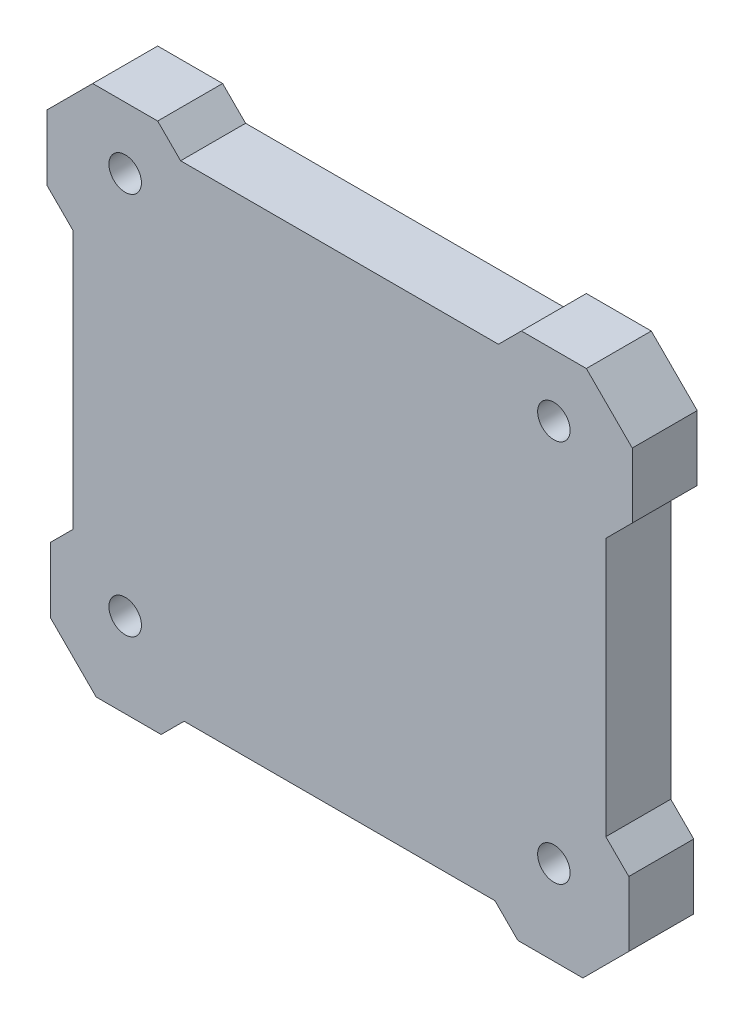
from build123d import *

# Parameters (mm, degrees)
CROQUIS1_W                   = 82
CROQUIS1_H                   = 78
CROQUIS1_R                   = 2.5
SALIENTE_EXTRUIR5_DEPTH      = 10
SALIENTE_EXTRUIR7_DEPTH      = 10
CORTAR_EXTRUIR_L_MINA1_START = -10
CORTAR_EXTRUIR_L_MINA1_DEPTH = 10


# Read off the part's stored shape, not the designer's step: Cortar-Extruir-Lámina1
with BuildPart() as part:
    # Croquis1 → Saliente-Extruir5 (new body)
    with BuildSketch(Plane.XY):
        Rectangle(CROQUIS1_W, CROQUIS1_H)
        with Locations((-33, 29.5)):
            Circle(CROQUIS1_R, mode=Mode.SUBTRACT)
        with Locations((33, 29.5)):
            Circle(CROQUIS1_R, mode=Mode.SUBTRACT)
        with Locations((33, -29.5)):
            Circle(CROQUIS1_R, mode=Mode.SUBTRACT)
        with Locations((-33, -29.5)):
            Circle(CROQUIS1_R, mode=Mode.SUBTRACT)
    extrude(amount=SALIENTE_EXTRUIR5_DEPTH)

    # Croquis6 → Saliente-Extruir7 (add, through all)
    with BuildSketch(Plane.XY.offset(10)):
        Polygon((-41, 17.857864376), (-41, 36), (-45.071067812, 31.928932188), (-45.071067812, 21.928932188), align=None)
        Polygon((45.071067812, 31.928932188), (41, 36), (41, 17.857864376), (45.071067812, 21.928932188), align=None)
        Polygon((-41, -39), (-41, -21.928932188), (-44.535533906, -25.464466094), (-44.535533906, -35.464466094), align=None)
        Polygon((44.535533906, -25.464466094), (41, -21.928932188), (41, -39), (44.535533906, -35.464466094), align=None)
        Polygon((-23.928932188, -39), (-41, -39), (-37.464466094, -42.535533906), (-27.464466094, -42.535533906), align=None)
        Polygon((37.464466094, -42.535533906), (41, -39), (23.928932188, -39), (27.464466094, -42.535533906), align=None)
    extrude(amount=-SALIENTE_EXTRUIR7_DEPTH)

    # Cortar-Extruir-Lámina1 outline → Cortar-Extruir-Lámina1 (cut)
    with BuildSketch(Plane.XY.offset(10).offset(CORTAR_EXTRUIR_L_MINA1_START)):
        Polygon((41, 39), (38, 39), (41, 36), align=None)
        Polygon((28, 39), (-28, 39), (-24.464466094, 35.464466094), (24.464466094, 35.464466094), align=None)
        Polygon((-41, 36), (-38, 39), (-41, 39), align=None)
    extrude(amount=CORTAR_EXTRUIR_L_MINA1_DEPTH, mode=Mode.SUBTRACT)


solid = part.part
